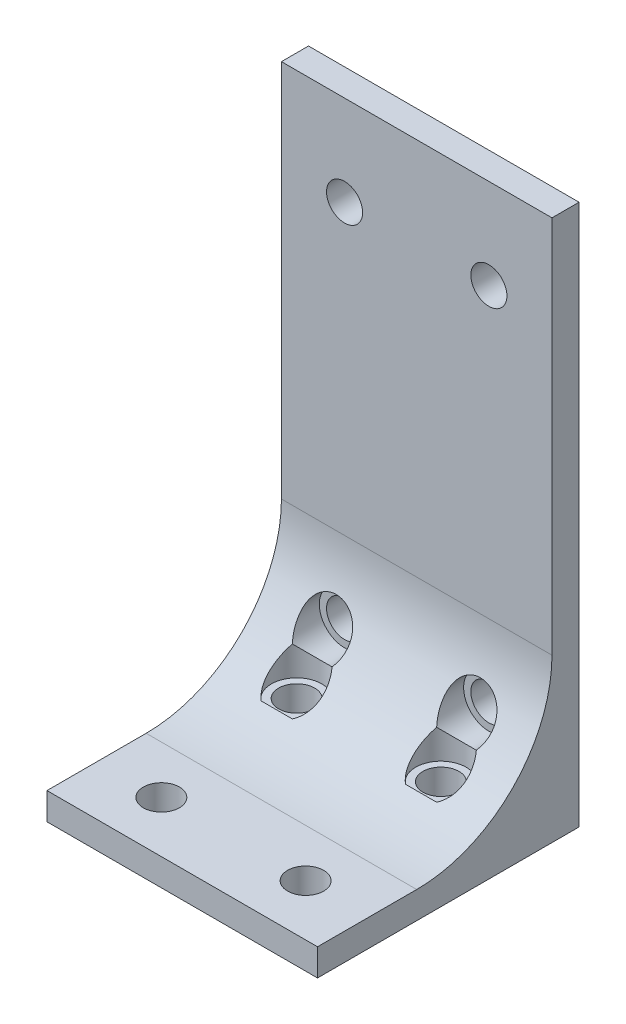
from build123d import *

# Parameters (mm, degrees)
SKETCH1_W           = 30
SKETCH1_H           = 60
SKETCH1_R           = 2
BOSS_EXTRUDE1_DEPTH = 3
SKETCH2_W           = 26
SKETCH2_H           = 3
BOSS_EXTRUDE2_DEPTH = 15
SKETCH3_R           = 2
CUT_EXTRUDE1_DEPTH  = 66.6886596
FILLET1_R           = 15
CUT_EXTRUDE2_START  = 2
SKETCH4_R           = 2.8
CUT_EXTRUDE2_DEPTH  = 64.688659622
SKETCH5_R           = 2.8
CUT_EXTRUDE3_DEPTH  = 43.438190383


with BuildPart() as part:
    # Sketch1 → Boss-Extrude1 (new body)
    with BuildSketch(Plane.XY):
        Rectangle(SKETCH1_W, SKETCH1_H)
        with Locations((8, 20)):
            Circle(SKETCH1_R, mode=Mode.SUBTRACT)
        with Locations(Location((8, -20, 0), (0, 0, 180))):
            Circle(SKETCH1_R, mode=Mode.SUBTRACT)
        with Locations(Location((-8, 20, 0), (0, 0, 180))):
            Circle(SKETCH1_R, mode=Mode.SUBTRACT)
        with Locations((-8, -20)):
            Circle(SKETCH1_R, mode=Mode.SUBTRACT)
    extrude(amount=BOSS_EXTRUDE1_DEPTH)

    # Sketch2 → Boss-Extrude2 (add, symmetric)
    with BuildSketch(Plane(origin=(0, 0, 0), x_dir=(0, 0, -1), z_dir=(1, 0, 0))):
        with Locations((-16, -28.5)):
            Rectangle(SKETCH2_W, SKETCH2_H)
    extrude(amount=BOSS_EXTRUDE2_DEPTH, both=True)

    # Sketch3 → Cut-Extrude1 (cut, through all)
    with BuildSketch(Plane(origin=(0, -27, 0), x_dir=(1, 0, 0), z_dir=(0, 1, 0))):
        with Locations(Location((-8, -8.31541538, 0), (0, 0, 270))):
            Circle(SKETCH3_R)
        with Locations(Location((8, -8.31541538, 0), (0, 0, 270))):
            Circle(SKETCH3_R)
        with Locations(Location((-8, -23.31541538, 0), (0, 0, 270))):
            Circle(SKETCH3_R)
        with Locations(Location((8, -23.31541538, 0), (0, 0, 270))):
            Circle(SKETCH3_R)
    extrude(amount=-CUT_EXTRUDE1_DEPTH, mode=Mode.SUBTRACT)

    # Fillet1
    # the kernel refuses this fillet: 15 mm, written as the material it adds along each edge
    with BuildSketch(Plane(origin=(-15, -27, 3), x_dir=(0, 1, 0), z_dir=(1, 0, 0))) as fillet1_piece_1_section:
        with BuildLine():
            CenterArc((FILLET1_R, FILLET1_R), FILLET1_R, 180, 90)
            Line((0, FILLET1_R), (0, 0))
            Line((0, 0), (FILLET1_R, 0))
        make_face()
    fillet1_piece_1 = extrude(amount=30, mode=Mode.PRIVATE)
    fillet1_piece_1 = fillet1_piece_1 - Plane(origin=(-8, -20, 6.3866805), x_dir=(1, 0, 0), z_dir=(0, 0, -1)) * Cylinder(2, 120, mode=Mode.PRIVATE)
    fillet1_piece_1 = fillet1_piece_1 - Plane(origin=(8, -20, 6.3866805), x_dir=(-1, 0, 0), z_dir=(0, 0, -1)) * Cylinder(2, 120, mode=Mode.PRIVATE)
    fillet1_piece_1 = fillet1_piece_1 - Plane(origin=(-8, -23.64475421, 8.31541538), x_dir=(0, 0, 1), z_dir=(0, 1, 0)) * Cylinder(2, 120, mode=Mode.PRIVATE)
    fillet1_piece_1 = fillet1_piece_1 - Plane(origin=(8, -23.64475421, 8.31541538), x_dir=(0, 0, 1), z_dir=(0, 1, 0)) * Cylinder(2, 120, mode=Mode.PRIVATE)
    add(fillet1_piece_1)

    # Sketch4 → Cut-Extrude2 (cut, through all)
    with BuildSketch(Plane(origin=(0, -27, 0), x_dir=(1, 0, 0), z_dir=(0, 1, 0)).offset(CUT_EXTRUDE2_START)):
        with Locations((-8, -8.31541538)):
            Circle(SKETCH4_R)
        with Locations((8, -8.31541538)):
            Circle(SKETCH4_R)
    extrude(amount=CUT_EXTRUDE2_DEPTH, mode=Mode.SUBTRACT)

    # Sketch5 → Cut-Extrude3 (cut, through all)
    with BuildSketch(Plane.XY.offset(3)):
        with Locations(Location((-8, -20, 0), (0, 0, 218.180965893))):
            Circle(SKETCH5_R)
        with Locations(Location((8, -20, 0), (0, 0, 218.180965893))):
            Circle(SKETCH5_R)
    extrude(amount=CUT_EXTRUDE3_DEPTH, mode=Mode.SUBTRACT)


solid = part.part
